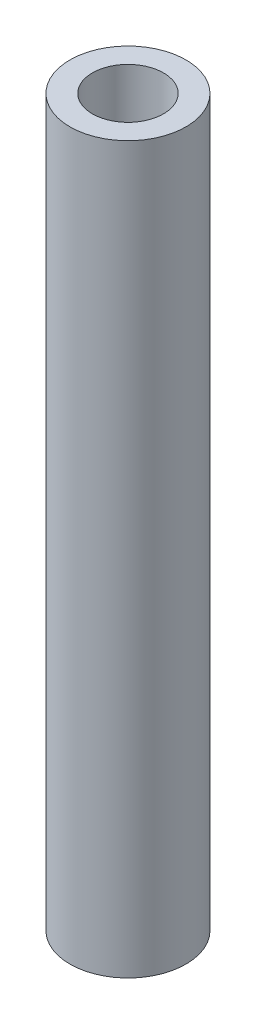
from build123d import *

# Parameters (mm, degrees)
SKETCH1_R           = 4
SKETCH1_R_2         = 2.45
BOSS_EXTRUDE1_DEPTH = 50


with BuildPart() as part:
    # Sketch1 → Boss-Extrude1 (new body)
    with BuildSketch(Plane(origin=(0, 0, 0), x_dir=(1, 0, 0), z_dir=(0, 1, 0))):
        Circle(SKETCH1_R)
        Circle(SKETCH1_R_2, mode=Mode.SUBTRACT)
    extrude(amount=BOSS_EXTRUDE1_DEPTH)


solid = part.part
